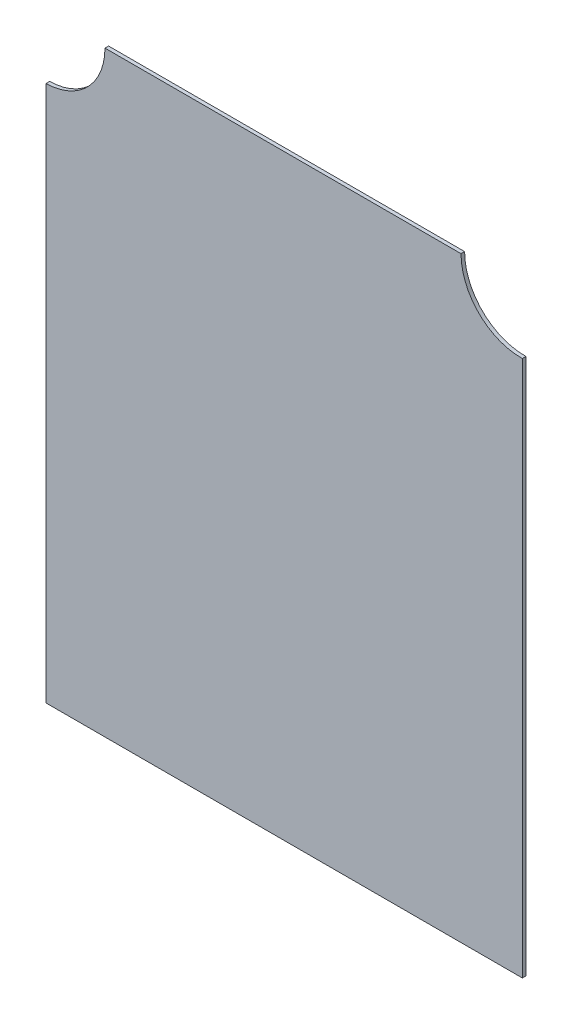
from build123d import *

# Parameters (mm, degrees)
SKETCH_1_W          = 396
SKETCH_1_H          = 496
EXTRUDE_5892_DEPTH  = 3
SKETCH_3_R          = 50
CUT_EXTRUDE_1_DEPTH = 3
SKETCH_4_R          = 50
CUT_EXTRUDE_2_DEPTH = 3


with BuildPart() as part:
    # Эскиз1 → Extrude 5892 (new body)
    with BuildSketch(Plane.XY):
        with Locations((198, 248)):
            Rectangle(SKETCH_1_W, SKETCH_1_H)
    extrude(amount=EXTRUDE_5892_DEPTH)

    # Эскиз3 → Cut-Extrude 1 (cut)
    with BuildSketch(Plane.XY.offset(3)):
        with Locations((-1, 496)):
            Circle(SKETCH_3_R)
    extrude(amount=-CUT_EXTRUDE_1_DEPTH, mode=Mode.SUBTRACT)

    # Эскиз4 → Cut-Extrude 2 (cut)
    with BuildSketch(Plane.XY.offset(3)):
        with Locations((395, 496)):
            Circle(SKETCH_4_R)
    extrude(amount=-CUT_EXTRUDE_2_DEPTH, mode=Mode.SUBTRACT)


solid = part.part
